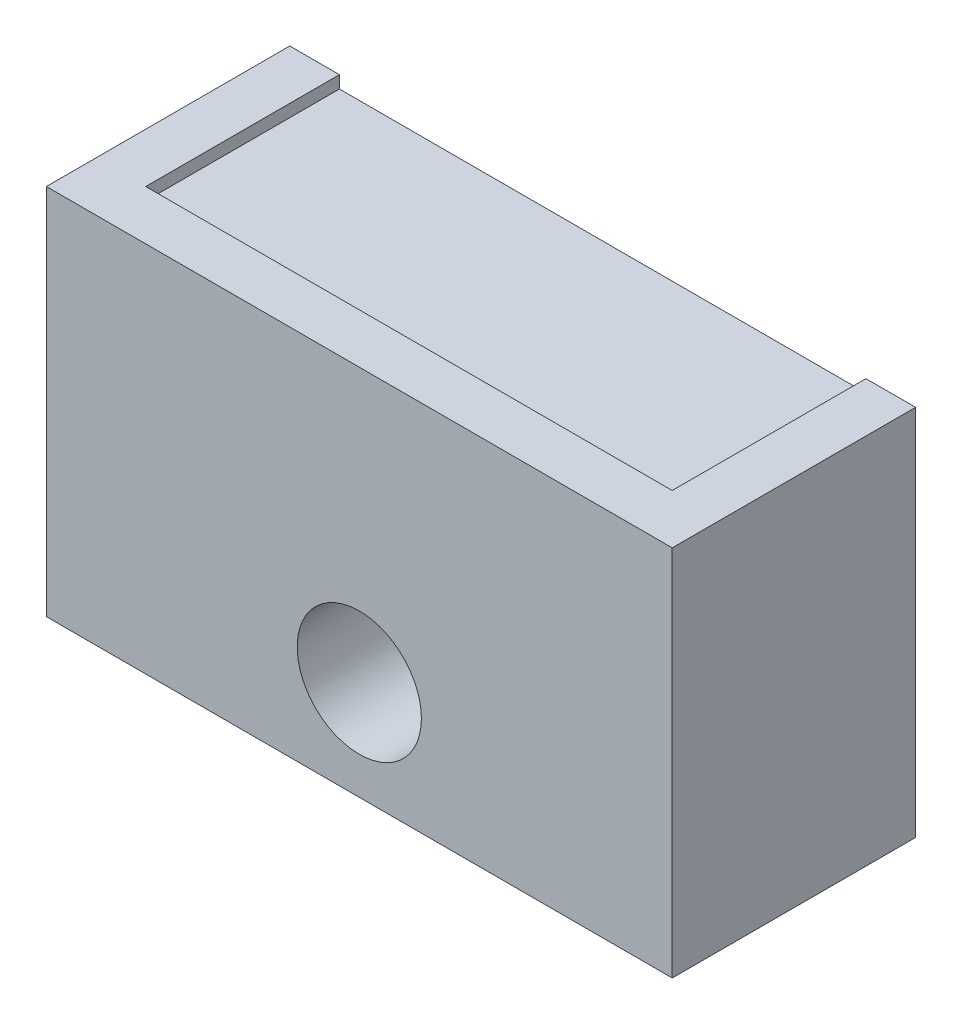
from build123d import *

# Parameters (mm, degrees)
SKETCH2_W           = 25.2
SKETCH2_H           = 15
BOSS_EXTRUDE2_DEPTH = 2
BOSS_EXTRUDE3_DEPTH = 7.8
SKETCH8_W           = 2.35
SKETCH8_H           = 8.163083502
SKETCH8_W_2         = 6.497887862
BOSS_EXTRUDE6_DEPTH = 7.8
SKETCH9_W           = 5
SKETCH9_H           = 8.163083502
SKETCH9_W_2         = 5.002112138
BOSS_EXTRUDE7_DEPTH = 1.3
SKETCH10_W          = 21.2
SKETCH10_H          = 7.8
CUT_EXTRUDE3_DEPTH  = 0.5
SKETCH12_R          = 1
CUT_EXTRUDE4_DEPTH  = 31.920543333
SKETCH13_R          = 2.5
CUT_EXTRUDE5_DEPTH  = 5.634787343


with BuildPart() as part:
    # Sketch2 → Boss-Extrude2 (new body)
    with BuildSketch(Plane.XY):
        with Locations((-12.6, 7.5)):
            Rectangle(SKETCH2_W, SKETCH2_H)
    extrude(amount=BOSS_EXTRUDE2_DEPTH)

    # Sketch3 → Boss-Extrude3 (add)
    with BuildSketch(Plane(origin=(0, 0, 0), x_dir=(-1, 0, 0), z_dir=(0, 0, -1))):
        Polygon((0, 15), (0, 0), (2, 0), (2, 13), (23.2, 13), (23.2, 0), (25.2, 0), (25.2, 15), align=None)
    extrude(amount=BOSS_EXTRUDE3_DEPTH)

    # Sketch8 → Boss-Extrude6 (add)
    with BuildSketch(Plane(origin=(0, 0, 0), x_dir=(-1, 0, 0), z_dir=(0, 0, -1))):
        with Locations((3.175, 4.081541751)):
            Rectangle(SKETCH8_W, SKETCH8_H)
        with Locations((12.598943931, 4.081541751)):
            Rectangle(SKETCH8_W_2, SKETCH8_H)
        with Locations((22.025, 4.081541751)):
            Rectangle(SKETCH8_W, SKETCH8_H)
    extrude(amount=BOSS_EXTRUDE6_DEPTH)

    # Sketch9 → Boss-Extrude7 (add)
    with BuildSketch(Plane(origin=(0, 0, 0), x_dir=(-1, 0, 0), z_dir=(0, 0, -1))):
        with Locations((6.85, 4.081541751)):
            Rectangle(SKETCH9_W, SKETCH9_H)
        with Locations((18.348943931, 4.081541751)):
            Rectangle(SKETCH9_W_2, SKETCH9_H)
    extrude(amount=BOSS_EXTRUDE7_DEPTH)

    # Sketch10 → Cut-Extrude3 (cut)
    with BuildSketch(Plane(origin=(0, 15, 0), x_dir=(1, 0, 0), z_dir=(0, 1, 0))):
        with Locations((-12.6, 3.9)):
            Rectangle(SKETCH10_W, SKETCH10_H)
    extrude(amount=-CUT_EXTRUDE3_DEPTH, mode=Mode.SUBTRACT)

    # Sketch12 → Cut-Extrude4 (cut, through all)
    with BuildSketch(Plane.XY.offset(2)):
        with Locations((-12.6, 4)):
            Circle(SKETCH12_R)
    extrude(amount=-CUT_EXTRUDE4_DEPTH, mode=Mode.SUBTRACT)

    # Sketch13 → Cut-Extrude5 (cut)
    with BuildSketch(Plane.XY.offset(2)):
        with Locations((-12.6, 4)):
            Circle(SKETCH13_R)
    extrude(amount=-CUT_EXTRUDE5_DEPTH, mode=Mode.SUBTRACT)


solid = part.part
